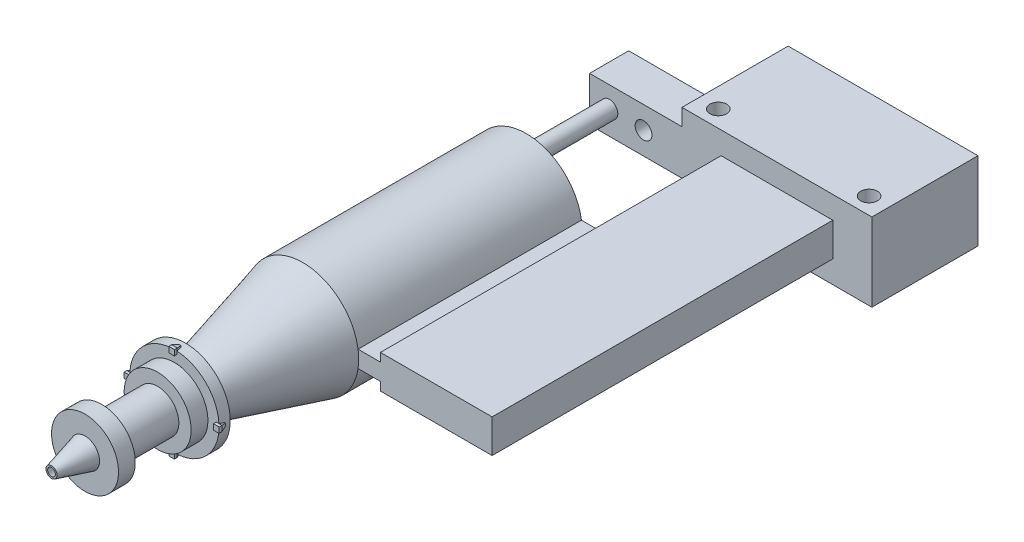
from build123d import *

# Parameters (mm, degrees)
SKETCH1_R                     = 127
BOSS_EXTRUDE1_DEPTH           = 254
BOSS_EXTRUDE1_TAPER           = 15
SKETCH4_R                     = 101.6
CUT_EXTRUDE1_DEPTH            = 254
CUT_EXTRUDE1_DRAFT            = -15
SKETCH1_6_R                   = 127
SKETCH1_6_R_2                 = 101.6
EXTRUDE_THIN2_DEPTH           = 508
SKETCH7_R                     = 76.2
SKETCH7_R_2                   = 38.1
EXTRUDE_THIN3_DEPTH           = 12.7
EXTRUDE_THIN4_START           = 12.7
SKETCH7_3_R                   = 101.6
SKETCH7_3_R_2                 = 76.2
EXTRUDE_THIN4_DEPTH           = 25.4
EXTRUDE_THIN5_START           = 38.1
SKETCH7_4_R                   = 76.2
SKETCH7_4_R_2                 = 33.02
EXTRUDE_THIN5_DEPTH           = 38.1
SKETCH9_R                     = 48.26
SKETCH9_R_2                   = 33.02
EXTRUDE_THIN6_DEPTH           = 127
EXTRUDE_THIN7_START           = 203.2
SKETCH7_6_R                   = 76.2
SKETCH7_6_R_2                 = 33.02
EXTRUDE_THIN7_DEPTH           = 38.1
BOSS_EXTRUDE3_START           = 165.1
SKETCH9_2_R                   = 33.02
BOSS_EXTRUDE3_DEPTH           = 76.2
BOSS_EXTRUDE3_TAPER           = 15
SKETCH10_R                    = 8.89
CUT_EXTRUDE2_DEPTH            = 76.2
CUT_EXTRUDE2_DRAFT            = 15
SKETCH12_W                    = 12.7
SKETCH12_H                    = 12.7
BOSS_EXTRUDE4_DEPTH           = 12.7
BOSS_EXTRUDE4_TAPER           = 17
BOSS_EXTRUDE4_OTHER_WAY_DEPTH = 6.35
CIRPATTERN1_START             = -104.067220345
CIRPATTERN1_DEPTH             = 8.817220345
CIRPATTERN1_START_2           = 95.25
CIRPATTERN1_2_DEPTH           = 8.817220345
CIRPATTERN1_3_DEPTH           = 12.7
CIRPATTERN1_START_3           = -6.35
CIRPATTERN1_4_DEPTH           = 12.7
CIRPATTERN1_START_4           = -95.25
CIRPATTERN1_5_DEPTH           = 190.5
CIRPATTERN1_START_5           = -109
CIRPATTERN1_6_DEPTH           = 4.932779655
CIRPATTERN1_START_6           = 104.067220345
CIRPATTERN1_7_DEPTH           = 4.932779655
BOSS_EXTRUDE14_START          = -508
BOSS_EXTRUDE14_DEPTH          = 508
SKETCH16_W                    = 4.430078534
SKETCH16_H                    = 38.095908877
CUT_EXTRUDE3_DEPTH            = 612.844825099
SKETCH17_W                    = 1016
SKETCH17_H                    = 76.2
BOSS_EXTRUDE15_DEPTH          = 254
SKETCH19_W                    = 431.8
SKETCH19_H                    = 177.8
BOSS_EXTRUDE16_DEPTH          = 241.3
SKETCH22_R                    = 19.05
CUT_EXTRUDE7_DEPTH            = 1162.250618699
SKETCH21_R                    = 19.05
CUT_EXTRUDE8_DEPTH            = 1162.250618699
BOSS_EXTRUDE21_START          = -774.7
SKETCH26_W                    = 245.254344596
SKETCH26_H                    = 101.6
BOSS_EXTRUDE21_DEPTH          = 88.9
CUT_EXTRUDE11_START           = -762
SKETCH27_R                    = 19.05
CUT_EXTRUDE11_DEPTH           = 127
EXTRUDE_THIN8_START           = -774.7
SKETCH26_9_R                  = 19.05
SKETCH26_9_R_2                = 16.51
EXTRUDE_THIN8_DEPTH           = 273.812


with BuildPart() as part:
    # Sketch1 → Boss-Extrude1 (new body)
    with BuildSketch(Plane.XY):
        Circle(SKETCH1_R)
    extrude(amount=BOSS_EXTRUDE1_DEPTH, taper=BOSS_EXTRUDE1_TAPER)


with BuildPart() as cut_extrude1_tool:
    # Sketch4 → Cut-Extrude1 (with draft: the straight prism first)
    with BuildSketch(Plane(origin=(0, 0, 0), x_dir=(-1, 0, 0), z_dir=(0, 0, -1))):
        Circle(SKETCH4_R)
    extrude(amount=-CUT_EXTRUDE1_DEPTH)
    # Cut-Extrude1: the draft: its side faces are tilted about the plane it starts from
    cut_extrude1_sides = [cut_extrude1_tool.faces().sort_by_distance(p)[0] for p in [
        (101.6, 0, 127),
    ]]
    draft(cut_extrude1_sides, Plane(origin=(0, 0, 0), x_dir=(-1, 0, 0), z_dir=(0, 0, -1)), CUT_EXTRUDE1_DRAFT)


with BuildPart() as part_1:
    add(part.part)

    # Cut-Extrude1: cut by cut_extrude1_tool
    add(cut_extrude1_tool.part, mode=Mode.SUBTRACT)

    # Sketch1<6> → Extrude-Thin2 (add)
    with BuildSketch(Plane.XY):
        Circle(SKETCH1_6_R)
        Circle(SKETCH1_6_R_2, mode=Mode.SUBTRACT)
    extrude(amount=-EXTRUDE_THIN2_DEPTH)

    # Sketch7 → Extrude-Thin3 (add)
    with BuildSketch(Plane.XY.offset(254)):
        Circle(SKETCH7_R)
        Circle(SKETCH7_R_2, mode=Mode.SUBTRACT)
    extrude(amount=EXTRUDE_THIN3_DEPTH)

    # Boss-Extrude14: read off the stored shape, not the designer's step
    # Boss-Extrude14 outline → Boss-Extrude14 (add)
    with BuildSketch(Plane.XY.offset(BOSS_EXTRUDE14_START)):
        with BuildLine():
            Line((125.563121576, -19.05), (176.363121576, -19.05))
            ThreePointArc((176.363121576, -19.05), (177.8, 0), (176.363121576, 19.05))
            Line((176.363121576, 19.05), (125.563121576, 19.05))
            ThreePointArc((125.563121576, 19.05), (127, 0), (125.563121576, -19.05))
        make_face()
    extrude(amount=BOSS_EXTRUDE14_DEPTH)

    # Sketch16 → Cut-Extrude3 (cut, through all)
    with BuildSketch(Plane.XY):
        with Locations((178.578160843, 0.002045561)):
            Rectangle(SKETCH16_W, SKETCH16_H)
    extrude(amount=-CUT_EXTRUDE3_DEPTH, mode=Mode.SUBTRACT)

    # Sketch17 → Boss-Extrude15 (add)
    with BuildSketch(Plane(origin=(176.363121576, 0, 0), x_dir=(0, 0, -1), z_dir=(1, 0, 0))):
        with Locations((508, 0.002045562)):
            Rectangle(SKETCH17_W, SKETCH17_H)
    extrude(amount=BOSS_EXTRUDE15_DEPTH)

    # Sketch19 → Boss-Extrude16 (add)
    with BuildSketch(Plane(origin=(0, 0, -1016), x_dir=(-1, 0, 0), z_dir=(0, 0, -1))):
        with Locations((-303.363121576, 0)):
            Rectangle(SKETCH19_W, SKETCH19_H)
    extrude(amount=-BOSS_EXTRUDE16_DEPTH)

    # Sketch22 → Cut-Extrude7 (cut, through all)
    with BuildSketch(Plane(origin=(0, 88.9, 0), x_dir=(1, 0, 0), z_dir=(0, 1, 0))):
        with Locations(Location((131.913121576, 812.8, 0), (0, 0, 180))):
            Circle(SKETCH22_R)
    extrude(amount=-CUT_EXTRUDE7_DEPTH, mode=Mode.SUBTRACT)

    # Sketch21 → Cut-Extrude8 (cut, through all)
    with BuildSketch(Plane(origin=(0, 88.9, 0), x_dir=(1, 0, 0), z_dir=(0, 1, 0))):
        with Locations(Location((474.813121576, 812.8, 0), (0, 0, 180))):
            Circle(SKETCH21_R)
    extrude(amount=-CUT_EXTRUDE8_DEPTH, mode=Mode.SUBTRACT)

    # Sketch26 → Boss-Extrude21 (add)
    with BuildSketch(Plane.XY.offset(BOSS_EXTRUDE21_START)):
        Rectangle(SKETCH26_W, SKETCH26_H)
    extrude(amount=-BOSS_EXTRUDE21_DEPTH)

    # Sketch27 → Cut-Extrude11 (cut)
    with BuildSketch(Plane.XY.offset(CUT_EXTRUDE11_START)):
        Circle(SKETCH27_R)
    extrude(amount=-CUT_EXTRUDE11_DEPTH, mode=Mode.SUBTRACT)

    # Sketch26<9> → Extrude-Thin8 (add)
    with BuildSketch(Plane.XY.offset(EXTRUDE_THIN8_START)):
        with Locations((-77.542660474, 3.112631732)):
            Circle(SKETCH26_9_R)
        with Locations((-77.542660474, 3.112631732)):
            Circle(SKETCH26_9_R_2, mode=Mode.SUBTRACT)
    extrude(amount=EXTRUDE_THIN8_DEPTH)


with BuildPart() as body_2:
    # Sketch7<3> → Extrude-Thin4 (new body)
    with BuildSketch(Plane.XY.offset(254).offset(EXTRUDE_THIN4_START)):
        Circle(SKETCH7_3_R)
        Circle(SKETCH7_3_R_2, mode=Mode.SUBTRACT)
    extrude(amount=EXTRUDE_THIN4_DEPTH)

    # Sketch12 → Boss-Extrude4 (add)
    with BuildSketch(Plane.XY.offset(292.1)):
        with Locations((0, -101.6)):
            Rectangle(SKETCH12_W, SKETCH12_H)
    extrude(amount=-BOSS_EXTRUDE4_DEPTH, taper=BOSS_EXTRUDE4_TAPER)

    # Sketch12 → Boss-Extrude4 other way (add)
    with BuildSketch(Plane.XY.offset(292.1)):
        with Locations((0, -101.6)):
            Rectangle(SKETCH12_W, SKETCH12_H)
    extrude(amount=BOSS_EXTRUDE4_OTHER_WAY_DEPTH)

    # CirPattern1: read off the stored shape, not the designer's step
    # CirPattern1 outline → CirPattern1 (add)
    with BuildSketch(Plane.YZ.offset(CIRPATTERN1_START)):
        Polygon((6.35, 292.1), (6.35, 298.45), (-6.35, 298.45), (-6.35, 292.1), (-2.467220345, 279.4), (2.467220345, 279.4), align=None)
    extrude(amount=CIRPATTERN1_DEPTH)

    # CirPattern1 2 outline → CirPattern1 2 (add)
    with BuildSketch(Plane.YZ.offset(CIRPATTERN1_START_2)):
        Polygon((6.35, 292.1), (6.35, 298.45), (-6.35, 298.45), (-6.35, 292.1), (-2.467220345, 279.4), (2.467220345, 279.4), align=None)
    extrude(amount=CIRPATTERN1_2_DEPTH)

    # CirPattern1 3 outline → CirPattern1 3 (add)
    with BuildSketch(Plane(origin=(0, 0, 0), x_dir=(1, 0, 0), z_dir=(0, 1, 0)).offset(CIRPATTERN1_START_2)):
        Polygon((-2.467220345, -279.4), (-6.35, -292.1), (-6.35, -298.45), (6.35, -298.45), (6.35, -292.1), (2.467220345, -279.4), align=None)
    extrude(amount=CIRPATTERN1_3_DEPTH)

    # CirPattern1 4 outline → CirPattern1 4 (add)
    with BuildSketch(Plane(origin=(0, 0, 0), x_dir=(1, 0, 0), z_dir=(0, 1, 0)).offset(CIRPATTERN1_START_3)):
        Polygon((104.067220345, -279.4), (104.067220345, -298.45), (107.95, -298.45), (107.95, -292.1), align=None)
        Polygon((-107.95, -292.1), (-107.95, -298.45), (-104.067220345, -298.45), (-104.067220345, -279.4), align=None)
    extrude(amount=CIRPATTERN1_4_DEPTH)

    # CirPattern1 5 outline → CirPattern1 5 (cut)
    with BuildSketch(Plane.YZ.offset(CIRPATTERN1_START_4)):
        Polygon((107.95, 279.4), (107.95, 292.1), (104.067220345, 279.4), align=None)
    extrude(amount=CIRPATTERN1_5_DEPTH, mode=Mode.SUBTRACT)

    # CirPattern1 6 outline → CirPattern1 6 (cut)
    with BuildSketch(Plane.YZ.offset(CIRPATTERN1_START_5)):
        Polygon((-2.467220345, 279.4), (-6.35, 292.1), (-6.35, 279.4), align=None)
        Polygon((6.35, 292.1), (2.467220345, 279.4), (6.35, 279.4), align=None)
    extrude(amount=CIRPATTERN1_6_DEPTH, mode=Mode.SUBTRACT)

    # CirPattern1 7 outline → CirPattern1 7 (cut)
    with BuildSketch(Plane.YZ.offset(CIRPATTERN1_START_6)):
        Polygon((-2.467220345, 279.4), (-6.35, 292.1), (-6.35, 279.4), align=None)
        Polygon((6.35, 292.1), (2.467220345, 279.4), (6.35, 279.4), align=None)
    extrude(amount=CIRPATTERN1_7_DEPTH, mode=Mode.SUBTRACT)


with BuildPart() as body_3:
    # Sketch7<4> → Extrude-Thin5 (new body)
    with BuildSketch(Plane.XY.offset(254).offset(EXTRUDE_THIN5_START)):
        Circle(SKETCH7_4_R)
        Circle(SKETCH7_4_R_2, mode=Mode.SUBTRACT)
    extrude(amount=EXTRUDE_THIN5_DEPTH)

    # Sketch9 → Extrude-Thin6 (add)
    with BuildSketch(Plane.XY.offset(330.2)):
        Circle(SKETCH9_R)
        Circle(SKETCH9_R_2, mode=Mode.SUBTRACT)
    extrude(amount=EXTRUDE_THIN6_DEPTH)

    # Sketch7<6> → Extrude-Thin7 (add)
    with BuildSketch(Plane.XY.offset(254).offset(EXTRUDE_THIN7_START)):
        Circle(SKETCH7_6_R)
        Circle(SKETCH7_6_R_2, mode=Mode.SUBTRACT)
    extrude(amount=EXTRUDE_THIN7_DEPTH)


with BuildPart() as body_4:
    # Sketch9<2> → Boss-Extrude3 (new body)
    with BuildSketch(Plane.XY.offset(330.2).offset(BOSS_EXTRUDE3_START)):
        with Locations(Location((0, 0, 0), (0, 0, 180))):
            Circle(SKETCH9_2_R)
    extrude(amount=BOSS_EXTRUDE3_DEPTH, taper=BOSS_EXTRUDE3_TAPER)


with BuildPart() as cut_extrude2_tool:
    # Sketch10 → Cut-Extrude2 (with draft: the straight prism first)
    with BuildSketch(Plane.XY.offset(571.5)):
        Circle(SKETCH10_R)
    extrude(amount=-CUT_EXTRUDE2_DEPTH)
    # Cut-Extrude2: the draft: its side faces are tilted about the plane it starts from
    cut_extrude2_sides = [cut_extrude2_tool.faces().sort_by_distance(p)[0] for p in [
        (-8.89, 0, 533.4),
    ]]
    draft(cut_extrude2_sides, Plane.XY.offset(571.5), CUT_EXTRUDE2_DRAFT)


with BuildPart() as body_4_1:
    add(body_4.part)

    # Cut-Extrude2: cut by cut_extrude2_tool
    add(cut_extrude2_tool.part, mode=Mode.SUBTRACT)


solid = Compound([part_1.part, body_2.part, body_3.part, body_4_1.part])
